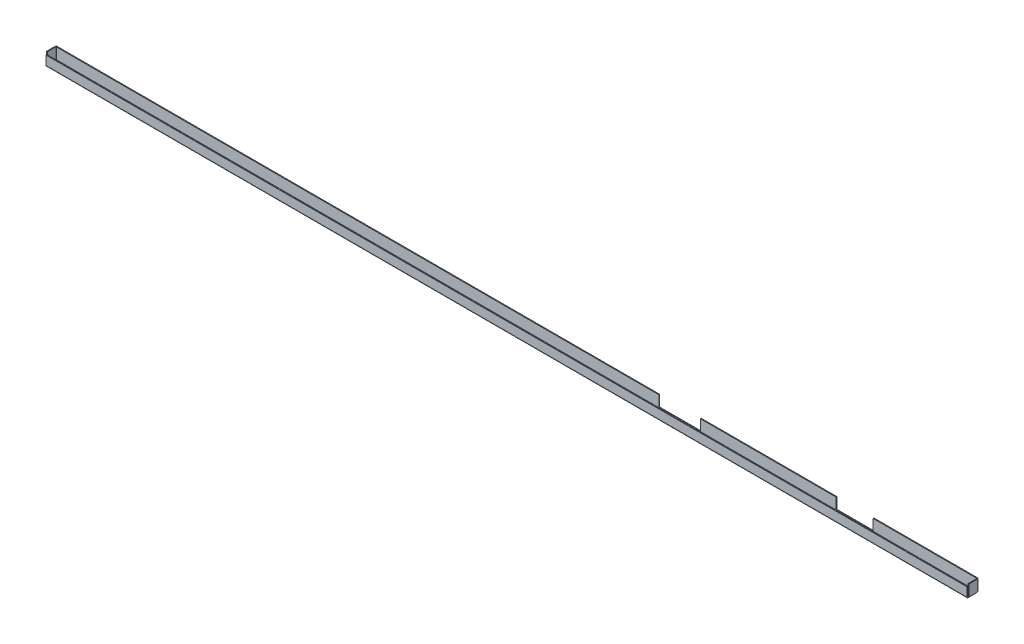
from build123d import *

# Parameters (mm, degrees)
SKETCH_1_W                         = 2104
SKETCH_1_H                         = 21
SM_BASE_FLANGE_1_DEPTH             = 2
SM_EDGE_FLANGE_1_STRIP_W           = 9.4732
SM_EDGE_FLANGE_1_STRIP_H           = 2
SM_EDGE_FLANGE_1_STRIP_CUT_DEPTH   = 2104
SM_EDGE_FLANGE_1_DEPTH             = 2104
SM_EDGE_FLANGE_2_STRIP_W           = 9.4732
SM_EDGE_FLANGE_2_STRIP_H           = 2
SM_EDGE_FLANGE_2_STRIP_CUT_DEPTH   = 2104
SM_EDGE_FLANGE_2_DEPTH             = 2104
SM_EDGE_FLANGE_3_STRIP_W           = 9.4732
SM_EDGE_FLANGE_3_STRIP_H           = 2
SM_EDGE_FLANGE_3_STRIP_CUT_DEPTH   = 25.2634
SM_EDGE_FLANGE_3_STRIP_2_W         = 9.4732
SM_EDGE_FLANGE_3_STRIP_2_H         = 2
SM_EDGE_FLANGE_3_STRIP_CUT_2_DEPTH = 25.2634
SM_EDGE_FLANGE_3_DEPTH             = 25.2634
SM_EDGE_FLANGE_3_BEND_DEPTH        = 25.2634
SKETCH_18_W                        = 85
SKETCH_18_H                        = 39.234140159
SKETCH_18_W_2                      = 95
SKETCH_18_H_2                      = 42.308601705
CUT_EXTRUDE_1_DEPTH                = 2
SKETCH_19_R                        = 6
CUT_EXTRUDE_2_DEPTH                = 0.1


# Sheet-metal steps are written as plain solids
with BuildPart() as part:
    # Sketch 1 → 基体-法兰1 (new body)
    with BuildSketch(Plane.XY):
        with Locations((-1050, 7.5)):
            Rectangle(SKETCH_1_W, SKETCH_1_H)
    extrude(amount=SM_BASE_FLANGE_1_DEPTH)

    # 边线-法兰1 strip (across the edge) → 边线-法兰1 strip cut (cut)
    with BuildSketch(Plane(origin=(2, -3, 0), x_dir=(0, 1, 0), z_dir=(-1, 0, 0))):
        with Locations((-4, -1)):
            Rectangle(SM_EDGE_FLANGE_1_STRIP_W, SM_EDGE_FLANGE_1_STRIP_H)
    extrude(amount=SM_EDGE_FLANGE_1_STRIP_CUT_DEPTH, mode=Mode.SUBTRACT)

    # 边线-法兰1 section (across the edge) → 边线-法兰1 (add)
    with BuildSketch(Plane(origin=(2, -3, 0), x_dir=(0, 1, 0), z_dir=(-1, 0, 0))):
        with BuildLine():
            Line((-2, 0.7366), (-2, 21))
            Line((-2, 21), (0, 21))
            Line((0, 21), (0, 0.7366))
            ThreePointArc((0, 0.7366), (0.215745145, 0.215745145), (0.7366, 0))
            Line((0.7366, 0), (0.7366, -2))
            ThreePointArc((0.7366, -2), (-1.198468417, -1.198468417), (-2, 0.7366))
        make_face()
    extrude(amount=SM_EDGE_FLANGE_1_DEPTH)

    # 边线-法兰2 strip (across the edge) → 边线-法兰2 strip cut (cut)
    with BuildSketch(Plane(origin=(2, -3, -21), x_dir=(0, 0, 1), z_dir=(-1, 0, 0))):
        with Locations((-4, -1)):
            Rectangle(SM_EDGE_FLANGE_2_STRIP_W, SM_EDGE_FLANGE_2_STRIP_H)
    extrude(amount=SM_EDGE_FLANGE_2_STRIP_CUT_DEPTH, mode=Mode.SUBTRACT)

    # 边线-法兰2 section (across the edge) → 边线-法兰2 (add)
    with BuildSketch(Plane(origin=(2, -3, -21), x_dir=(0, 0, 1), z_dir=(-1, 0, 0))):
        with BuildLine():
            Line((-2, 0.7366), (-2, 26))
            Line((-2, 26), (0, 26))
            Line((0, 26), (0, 0.7366))
            ThreePointArc((0, 0.7366), (0.215745145, 0.215745145), (0.7366, 0))
            Line((0.7366, 0), (0.7366, -2))
            ThreePointArc((0.7366, -2), (-1.198468417, -1.198468417), (-2, 0.7366))
        make_face()
    extrude(amount=SM_EDGE_FLANGE_2_DEPTH)

    # 边线-法兰3 strip (across the edge) → 边线-法兰3 strip cut (cut)
    with BuildSketch(Plane(origin=(2, -2.2634, -21), x_dir=(-1, 0, 0), z_dir=(0, 1, 0))):
        with Locations((-4, -1)):
            Rectangle(SM_EDGE_FLANGE_3_STRIP_W, SM_EDGE_FLANGE_3_STRIP_H)
    extrude(amount=SM_EDGE_FLANGE_3_STRIP_CUT_DEPTH, mode=Mode.SUBTRACT)

    # 边线-法兰3 strip 2 (across the edge) → 边线-法兰3 strip cut 2 (cut)
    with BuildSketch(Plane(origin=(-2102, 23, -21), x_dir=(1, 0, 0), z_dir=(0, -1, 0))):
        with Locations((-4, -1)):
            Rectangle(SM_EDGE_FLANGE_3_STRIP_2_W, SM_EDGE_FLANGE_3_STRIP_2_H)
    extrude(amount=SM_EDGE_FLANGE_3_STRIP_CUT_2_DEPTH, mode=Mode.SUBTRACT)

    # 边线-法兰3 section (across the edge) → 边线-法兰3 (add)
    with BuildSketch(Plane(origin=(2, -2.2634, -21), x_dir=(-1, 0, 0), z_dir=(0, 1, 0))):
        with BuildLine():
            Line((-2, 0.7366), (-2, 20))
            Line((-2, 20), (0, 20))
            Line((0, 20), (0, 0.7366))
            ThreePointArc((0, 0.7366), (0.215745145, 0.215745145), (0.7366, 0))
            Line((0.7366, 0), (0.7366, -2))
            ThreePointArc((0.7366, -2), (-1.198468417, -1.198468417), (-2, 0.7366))
        make_face()
    extrude(amount=SM_EDGE_FLANGE_3_DEPTH)

    # 边线-法兰3 section 2 (across the edge) → 边线-法兰3 bend (add)
    with BuildSketch(Plane(origin=(-2102, 23, -21), x_dir=(1, 0, 0), z_dir=(0, -1, 0))):
        with BuildLine():
            Line((-2, 0.7366), (-2, 20))
            Line((-2, 20), (0, 20))
            Line((0, 20), (0, 0.7366))
            ThreePointArc((0, 0.7366), (0.215745145, 0.215745145), (0.7366, 0))
            Line((0.7366, 0), (0.7366, -2))
            ThreePointArc((0.7366, -2), (-1.198468417, -1.198468417), (-2, 0.7366))
        make_face()
    extrude(amount=SM_EDGE_FLANGE_3_BEND_DEPTH)

    # 草图18 → 切除-拉伸1 (cut)
    with BuildSketch(Plane(origin=(0, 0, -23), x_dir=(-1, 0, 0), z_dir=(0, 0, -1))):
        with Locations((277.5, 17.35367008)):
            Rectangle(SKETCH_18_W, SKETCH_18_H)
        with Locations((677.5, 18.890900853)):
            Rectangle(SKETCH_18_W_2, SKETCH_18_H_2)
    extrude(amount=-CUT_EXTRUDE_1_DEPTH, mode=Mode.SUBTRACT)

    # 草图19 → 切除-拉伸2 (cut)
    with BuildSketch(Plane(origin=(0, 0, -23), x_dir=(-1, 0, 0), z_dir=(0, 0, -1))):
        with Locations((98.7366, 10.3683)):
            Circle(SKETCH_19_R)
        with Locations((478.7366, 10.3683)):
            Circle(SKETCH_19_R)
        with Locations((858.7366, 10.3683)):
            Circle(SKETCH_19_R)
        with Locations((1238.7366, 10.3683)):
            Circle(SKETCH_19_R)
        with Locations((1618.7366, 10.3683)):
            Circle(SKETCH_19_R)
        with Locations((1998.7366, 10.3683)):
            Circle(SKETCH_19_R)
    extrude(amount=-CUT_EXTRUDE_2_DEPTH, mode=Mode.SUBTRACT)


solid = part.part
